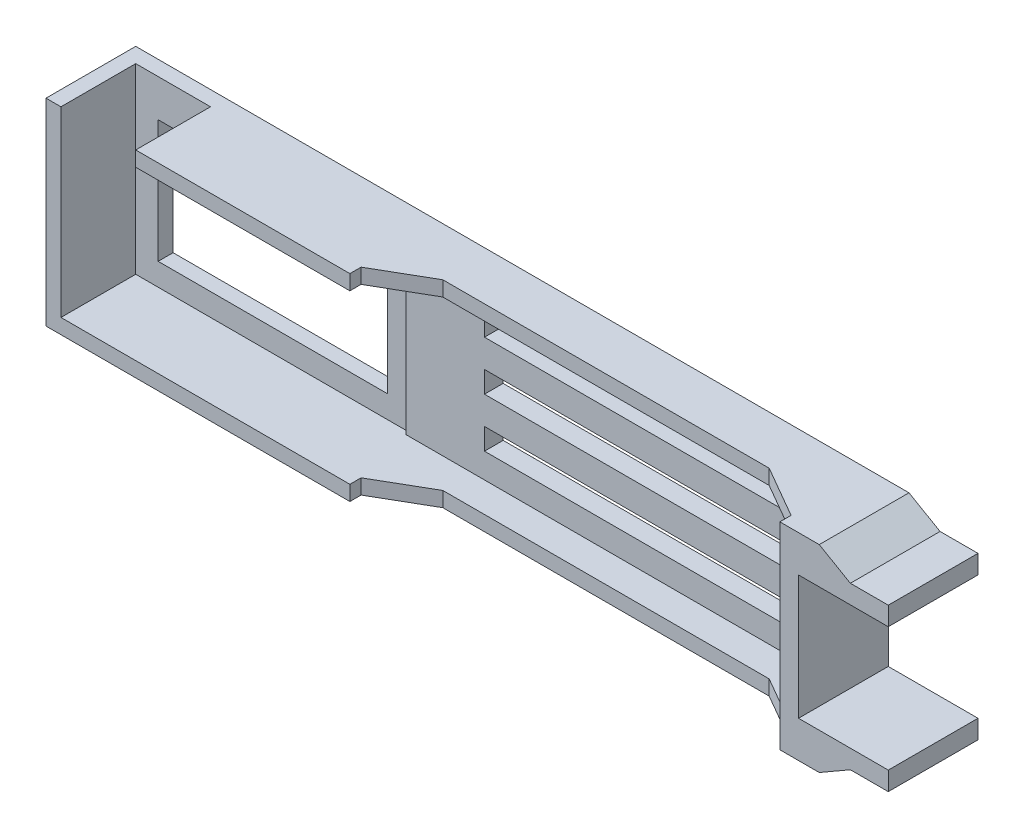
from build123d import *
from OCP.BRepFilletAPI import BRepFilletAPI_MakeChamfer

# Parameters (mm, degrees)
ESQUISSE1_W             = 20.32
ESQUISSE1_H             = 13.2
BOSS_EXTRU_1_DEPTH      = 6
ESQUISSE2_W             = 18.32
ESQUISSE2_H             = 11.2
ENL_V_MAT_EXTRU_1_DEPTH = 5
ESQUISSE3_W             = 5
ESQUISSE3_H             = 1
ENL_V_MAT_EXTRU_2_DEPTH = 5
ESQUISSE4_W             = 15.32
ESQUISSE4_H             = 8.2
ENL_V_MAT_EXTRU_3_DEPTH = 25.741511676
ESQUISSE6_W             = 1
ESQUISSE6_H             = 11.2
ENL_V_MAT_EXTRU_4_DEPTH = 4.75
ESQUISSE7_W             = 30
ESQUISSE7_H             = 13.2
BOSS_EXTRU_2_DEPTH      = 1.25
ESQUISSE8_W             = 1.25
ESQUISSE8_H             = 13.2
BOSS_EXTRU_3_DEPTH      = 4.75
ESQUISSE9_W             = 6
ESQUISSE9_H             = 1.25
BOSS_EXTRU_4_DEPTH      = 6
CHANFREIN1_SIZE         = 2
CHANFREIN1_SIZE_2       = 3.464101615
ESQUISSE10_W            = 28.75
ESQUISSE10_H            = 1
BOSS_EXTRU_5_DEPTH      = 2
CHANFREIN2_SIZE         = 2
CHANFREIN2_SIZE2        = 3.464101615
ESQUISSE11_W            = 21
ESQUISSE11_H            = 1.433492253
ENL_V_MAT_EXTRU_5_DEPTH = 2


with BuildPart() as part:
    # Esquisse1 → Boss.-Extru.1 (new body)
    with BuildSketch(Plane.XY):
        with Locations((10.16, 6.6)):
            Rectangle(ESQUISSE1_W, ESQUISSE1_H)
    extrude(amount=BOSS_EXTRU_1_DEPTH)

    # Esquisse2 → Enlèv. mat.-Extru.1 (cut)
    with BuildSketch(Plane.XY.offset(6)):
        with Locations((10.16, 6.6)):
            Rectangle(ESQUISSE2_W, ESQUISSE2_H)
    extrude(amount=-ENL_V_MAT_EXTRU_1_DEPTH, mode=Mode.SUBTRACT)

    # Esquisse3 → Enlèv. mat.-Extru.2 (cut)
    with BuildSketch(Plane.XY.offset(6)):
        with Locations((3.5, 12.7)):
            Rectangle(ESQUISSE3_W, ESQUISSE3_H)
    extrude(amount=-ENL_V_MAT_EXTRU_2_DEPTH, mode=Mode.SUBTRACT)

    # Esquisse4 → Enlèv. mat.-Extru.3 (cut, through all)
    with BuildSketch(Plane.XY.offset(1)):
        with Locations((10.16, 6.6)):
            Rectangle(ESQUISSE4_W, ESQUISSE4_H)
    extrude(amount=-ENL_V_MAT_EXTRU_3_DEPTH, mode=Mode.SUBTRACT)

    # Esquisse6 → Enlèv. mat.-Extru.4 (cut)
    with BuildSketch(Plane.XY.offset(6)):
        with Locations((19.82, 6.6)):
            Rectangle(ESQUISSE6_W, ESQUISSE6_H)
    extrude(amount=-ENL_V_MAT_EXTRU_4_DEPTH, mode=Mode.SUBTRACT)

    # Esquisse7 → Boss.-Extru.2 (add)
    with BuildSketch(Plane(origin=(0, 0, 0), x_dir=(-1, 0, 0), z_dir=(0, 0, -1))):
        with Locations((-35.32, 6.6)):
            Rectangle(ESQUISSE7_W, ESQUISSE7_H)
    extrude(amount=-BOSS_EXTRU_2_DEPTH)

    # Esquisse8 → Boss.-Extru.3 (add)
    with BuildSketch(Plane.XY.offset(1.25)):
        with Locations((49.695, 6.6)):
            Rectangle(ESQUISSE8_W, ESQUISSE8_H)
    extrude(amount=BOSS_EXTRU_3_DEPTH)

    # Esquisse9 → Boss.-Extru.4 (add)
    with BuildSketch(Plane(origin=(50.32, 0, 0), x_dir=(0, 0, -1), z_dir=(1, 0, 0))):
        with Locations((-3, 11.375)):
            Rectangle(ESQUISSE9_W, ESQUISSE9_H)
        with Locations((-3, 1.825)):
            Rectangle(ESQUISSE9_W, ESQUISSE9_H)
    extrude(amount=BOSS_EXTRU_4_DEPTH)

    # Chanfrein1
    # the kernel refuses this chamfer: 3.464101615, 2 mm, written as the material it adds along each edge
    with BuildSketch(Plane(origin=(50.32, 12, 6), x_dir=(-0.057893862402669756, 0.9983227437537926, 0), z_dir=(0, 0, -1))) as chanfrein1_piece_1_section:
        Polygon((CHANFREIN1_SIZE * 0.998322743754, CHANFREIN1_SIZE * 0.0578938624027), (-CHANFREIN1_SIZE_2 * 0.057893862405, CHANFREIN1_SIZE_2 * 0.998322743793), (0, 0), align=None)
    chanfrein1_piece_1 = extrude(amount=6, mode=Mode.PRIVATE)
    chanfrein1_piece_1 = split(chanfrein1_piece_1, bisect_by=Plane(origin=(51.640549775, 13.2, 3), z_dir=(0, -1, 0)), keep=Keep.TOP, mode=Mode.PRIVATE)
    add(chanfrein1_piece_1)
    with BuildSketch(Plane(origin=(50.32, 1.2, 0), x_dir=(-0.05789386240266974, -0.9983227437537926, 0), z_dir=(0, 0, 1))) as chanfrein1_piece_2_section:
        Polygon((CHANFREIN1_SIZE * 0.998322743754, CHANFREIN1_SIZE * 0.0578938624027), (-CHANFREIN1_SIZE_2 * 0.057893862405, CHANFREIN1_SIZE_2 * 0.998322743793), (0, 0), align=None)
    chanfrein1_piece_2 = extrude(amount=6, mode=Mode.PRIVATE)
    chanfrein1_piece_2 = split(chanfrein1_piece_2, bisect_by=Plane(origin=(51.640549775, 0, 3), z_dir=(0, 1, 0)), keep=Keep.TOP, mode=Mode.PRIVATE)
    add(chanfrein1_piece_2)

    # Esquisse10 → Boss.-Extru.5 (add)
    with BuildSketch(Plane.XY.offset(1.25)):
        with Locations((34.695, 12.7)):
            Rectangle(ESQUISSE10_W, ESQUISSE10_H)
        with Locations((34.695, 0.5)):
            Rectangle(ESQUISSE10_W, ESQUISSE10_H)
    extrude(amount=BOSS_EXTRU_5_DEPTH)

    # Chanfrein2: one chamfer whose edges measure the first distance from different faces: ONE call of the kernel's chamfer builder (chamfer() names one face for all edges)
    chanfrein2_edges_1 = [part.edges().sort_by_distance(p)[0] for p in [
        (20.32, 12.7, 3.25),
    ]]
    chanfrein2_side_1 = [part.faces().sort_by_distance(p)[0] for p in [
        (20.32, 12.7, 4.625),
    ]]
    chanfrein2_edges_2 = [part.edges().sort_by_distance(p)[0] for p in [
        (49.07, 12.7, 3.25),
        (49.07, 0.5, 3.25),
    ]]
    chanfrein2_side_2 = [part.faces().sort_by_distance(p)[0] for p in [
        (49.07, 6.6, 3.718696763),
    ]]
    chanfrein2_edges_3 = [part.edges().sort_by_distance(p)[0] for p in [
        (20.32, 0.5, 3.25),
    ]]
    chanfrein2_side_3 = [part.faces().sort_by_distance(p)[0] for p in [
        (20.32, 0.5, 4.625),
    ]]
    chanfrein2 = BRepFilletAPI_MakeChamfer(part.part.solid().wrapped)
    for e in chanfrein2_edges_1:
        chanfrein2.Add(CHANFREIN2_SIZE, CHANFREIN2_SIZE2, e.wrapped, chanfrein2_side_1[0].wrapped)  # the first distance lies on this face
    for e in chanfrein2_edges_2:
        chanfrein2.Add(CHANFREIN2_SIZE, CHANFREIN2_SIZE2, e.wrapped, chanfrein2_side_2[0].wrapped)  # the first distance lies on this face
    for e in chanfrein2_edges_3:
        chanfrein2.Add(CHANFREIN2_SIZE, CHANFREIN2_SIZE2, e.wrapped, chanfrein2_side_3[0].wrapped)  # the first distance lies on this face
    add(Compound.cast(chanfrein2.Shape()), mode=Mode.REPLACE)

    # Esquisse11 → Enlèv. mat.-Extru.5 (cut)
    with BuildSketch(Plane.XY.offset(1.25)):
        with Locations((35.07, 9.983253874)):
            Rectangle(ESQUISSE11_W, ESQUISSE11_H)
        with Locations((35.07, 6.683253873)):
            Rectangle(ESQUISSE11_W, ESQUISSE11_H)
        with Locations((35.07, 3.383253874)):
            Rectangle(ESQUISSE11_W, ESQUISSE11_H)
    extrude(amount=-ENL_V_MAT_EXTRU_5_DEPTH, mode=Mode.SUBTRACT)


solid = part.part
